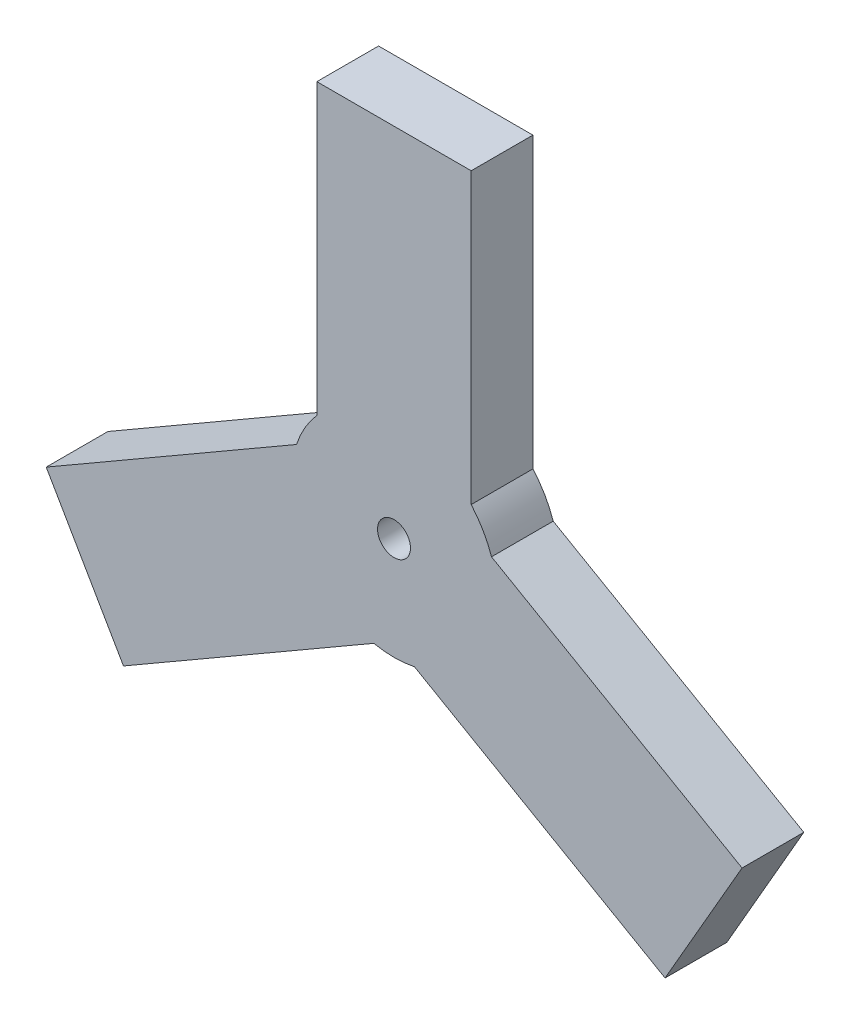
from build123d import *

# Parameters (mm, degrees)
SKETCH2_R           = 2.032
BOSS_EXTRUDE1_DEPTH = 7.62


with BuildPart() as part:
    # Sketch2 → Boss-Extrude1 (new body)
    with BuildSketch(Plane.XY):
        with BuildLine():
            Line((-12.040223173, 4.040176474), (-42.930784917, -13.823882004))
            Line((-42.930784917, -13.823882004), (-33.394022173, -30.314869129))
            Line((-33.394022173, -30.314869129), (-2.503460429, -12.450810651))
            ThreePointArc((-2.503460429, -12.450810651), (0.013585242, -12.699992734), (2.530092051, -12.445426237))
            Line((2.530092051, -12.445426237), (33.458801591, -30.243356351))
            Line((33.458801591, -30.243356351), (42.960261577, -13.732003949))
            Line((42.960261577, -13.732003949), (12.031552037, 4.065926165))
            ThreePointArc((12.031552037, 4.065926165), (10.993991417, 6.357841829), (9.525, 8.400260413))
            Line((9.525, 8.400260413), (9.525, 44.084309933))
            Line((9.525, 44.084309933), (-9.525, 44.084309933))
            Line((-9.525, 44.084309933), (-9.525, 8.400260413))
            ThreePointArc((-9.525, 8.400260413), (-11.000786136, 6.346077874), (-12.040223173, 4.040176474))
        make_face()
        Circle(SKETCH2_R, mode=Mode.SUBTRACT)
    extrude(amount=BOSS_EXTRUDE1_DEPTH)


solid = part.part
